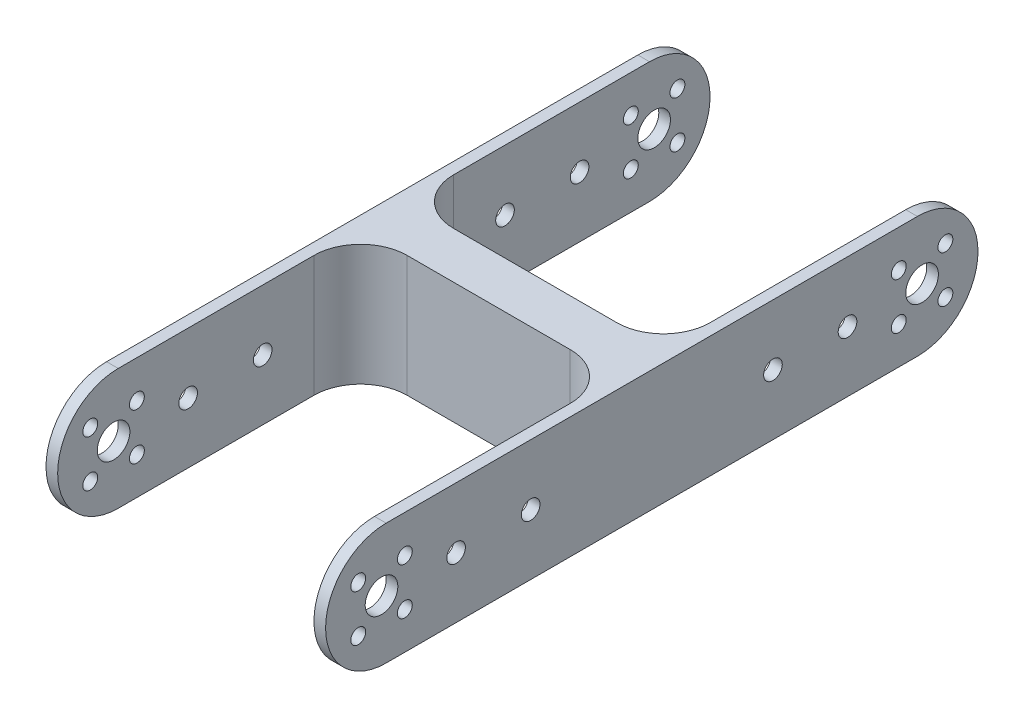
from build123d import *

# Parameters (mm, degrees)
EXTRUDE_1_DEPTH      = 26
SKETCH_2_R           = 2
SKETCH_2_R_2         = 3.5
SKETCH_2_R_3         = 1.6
CUT_EXTRUDE_2_DEPTH  = 155.518607294
CUT_EXTRUDE_5_DEPTH  = 155.518607294
SKETCH_5_R           = 10.5
CUT_EXTRUDE_6_DEPTH  = 1.6
CUT_EXTRUDE_START    = -1.6
SKETCH_6_R           = 10.5
CUT_EXTRUDE_7_DEPTH  = 1.6
SKETCH_7_R           = 10.5
CUT_EXTRUDE_8_DEPTH  = 1.6
SKETCH_8_R           = 10.5
CUT_EXTRUDE_9_DEPTH  = 1.6
SKETCH_9_W           = 55
SKETCH_9_H           = 54.794138709
CUT_EXTRUDE_11_DEPTH = 155.518607294
SKETCH_11_W          = 55
SKETCH_11_H          = 30.411722582
CUT_EXTRUDE_12_DEPTH = 155.518607294
EXTRUDE_2_DEPTH      = 26


with BuildPart() as part:
    # 草图1 → 凸台-拉伸1 (new body)
    with BuildSketch(Plane(origin=(0, 0, 0), x_dir=(1, 0, 0), z_dir=(0, 1, 0))):
        with BuildLine():
            Line((0, 0), (0, 140))
            Line((0, 140), (5, 140))
            Line((5, 140), (5, 85))
            ThreePointArc((5, 85), (7.928932188, 77.928932188), (15, 75))
            Line((15, 75), (45, 75))
            ThreePointArc((45, 75), (52.071067812, 77.928932188), (55, 85))
            Line((55, 85), (55, 140))
            Line((55, 140), (60, 140))
            Line((60, 140), (60, 0))
            Line((60, 0), (55, 0))
            Line((55, 0), (55, 55))
            ThreePointArc((55, 55), (52.071067812, 62.071067812), (45, 65))
            Line((45, 65), (15, 65))
            ThreePointArc((15, 65), (7.928932188, 62.071067812), (5, 55))
            Line((5, 55), (5, 0))
            Line((5, 0), (0, 0))
        make_face()
    extrude(amount=EXTRUDE_1_DEPTH)

    # 草图2 → 切除-拉伸2 (cut, through all)
    with BuildSketch(Plane(origin=(60, 0, 0), x_dir=(0, 0, -1), z_dir=(1, 0, 0))):
        with Locations((44, 13)):
            Circle(SKETCH_2_R)
        with Locations((28, 13)):
            Circle(SKETCH_2_R)
        with Locations((12, 13)):
            Circle(SKETCH_2_R_2)
        with Locations((7, 8)):
            Circle(SKETCH_2_R_3)
        with Locations((7, 18)):
            Circle(SKETCH_2_R_3)
        with Locations((17, 8)):
            Circle(SKETCH_2_R_3)
        with Locations((17, 18)):
            Circle(SKETCH_2_R_3)
        with Locations((96, 13)):
            Circle(SKETCH_2_R)
        with Locations((112, 13)):
            Circle(SKETCH_2_R)
        with Locations((123, 18)):
            Circle(SKETCH_2_R_3)
        with Locations((133, 18)):
            Circle(SKETCH_2_R_3)
        with Locations((133, 8)):
            Circle(SKETCH_2_R_3)
        with Locations((128, 13)):
            Circle(SKETCH_2_R_2)
        with Locations((123, 8)):
            Circle(SKETCH_2_R_3)
    extrude(amount=-CUT_EXTRUDE_2_DEPTH, mode=Mode.SUBTRACT)

    # 草图3 → 切除-拉伸5 (cut, through all)
    with BuildSketch(Plane.ZY):
        with BuildLine():
            Line((-127, 26), (-140, 26))
            Line((-140, 26), (-140, 13))
            ThreePointArc((-140, 13), (-136.192388155, 22.192388155), (-127, 26))
        make_face()
        with BuildLine():
            ThreePointArc((-127, 0), (-136.192388155, 3.807611845), (-140, 13))
            Line((-140, 13), (-140, 0))
            Line((-140, 0), (-127, 0))
        make_face()
        with BuildLine():
            Line((0, 26), (-13, 26))
            ThreePointArc((-13, 26), (-3.807611845, 22.192388155), (0, 13))
            Line((0, 13), (0, 26))
        make_face()
        with BuildLine():
            ThreePointArc((0, 13), (-3.807611845, 3.807611845), (-13, 0))
            Line((-13, 0), (0, 0))
            Line((0, 0), (0, 13))
        make_face()
    extrude(amount=-CUT_EXTRUDE_5_DEPTH, mode=Mode.SUBTRACT)

    # 草图5 → 切除-拉伸6 (cut)
    with BuildSketch(Plane.ZY.offset(-55)):
        with Locations((-128, 13)):
            Circle(SKETCH_5_R)
    extrude(amount=-CUT_EXTRUDE_6_DEPTH, mode=Mode.SUBTRACT)

    # 草图6 → 切除-拉伸7 (cut)
    with BuildSketch(Plane(origin=(5, 0, 0), x_dir=(0, 0, -1), z_dir=(1, 0, 0)).offset(CUT_EXTRUDE_START)):
        with Locations((128, 13)):
            Circle(SKETCH_6_R)
    extrude(amount=CUT_EXTRUDE_7_DEPTH, mode=Mode.SUBTRACT)

    # 草图7 → 切除-拉伸8 (cut)
    with BuildSketch(Plane.ZY.offset(-55)):
        with Locations((-12, 13)):
            Circle(SKETCH_7_R)
    extrude(amount=-CUT_EXTRUDE_8_DEPTH, mode=Mode.SUBTRACT)

    # 草图8 → 切除-拉伸9 (cut)
    with BuildSketch(Plane(origin=(5, 0, 0), x_dir=(0, 0, -1), z_dir=(1, 0, 0)).offset(CUT_EXTRUDE_START)):
        with Locations((12, 13)):
            Circle(SKETCH_8_R)
    extrude(amount=CUT_EXTRUDE_9_DEPTH, mode=Mode.SUBTRACT)

    # 草图9 → 切除-拉伸11 (cut, through all)
    with BuildSketch(Plane(origin=(0, 26, 0), x_dir=(1, 0, 0), z_dir=(0, 1, 0))):
        with Locations((30, 112.602930646)):
            Rectangle(SKETCH_9_W, SKETCH_9_H)
        with Locations((30, 27.397069355)):
            Rectangle(SKETCH_9_W, SKETCH_9_H)
    extrude(amount=-CUT_EXTRUDE_11_DEPTH, mode=Mode.SUBTRACT)

    # 草图11 → 切除-拉伸12 (cut, through all)
    with BuildSketch(Plane(origin=(0, 26, 0), x_dir=(1, 0, 0), z_dir=(0, 1, 0))):
        with Locations((30, 70)):
            Rectangle(SKETCH_11_W, SKETCH_11_H)
    extrude(amount=-CUT_EXTRUDE_12_DEPTH, mode=Mode.SUBTRACT)


with BuildPart() as cut_extrude_12_piece_1:
    # of the separate pieces the step leaves, piece 1, a body of its own (cut_extrude_12_pieces)
    add(part.part.solids().sort_by_distance((60, 0, -127))[0])



with BuildPart() as cut_extrude_12_piece_2:
    # of the separate pieces the step leaves, piece 2, a body of its own (cut_extrude_12_pieces)
    add(part.part.solids().sort_by_distance((0, 26, -127))[0])


with BuildPart() as cut_extrude_12_piece_1_1:
    add(cut_extrude_12_piece_1.part)

    add(cut_extrude_12_piece_2.part)  # 凸台-拉伸2 merges 切除-拉伸12 piece 2
    # 草图12 → 凸台-拉伸2 (add)
    with BuildSketch(Plane(origin=(0, 26, 0), x_dir=(1, 0, 0), z_dir=(0, 1, 0))):
        with BuildLine():
            ThreePointArc((2.5, 55), (5.428932188, 62.071067812), (12.5, 65))
            Line((12.5, 65), (47.5, 65))
            ThreePointArc((47.5, 65), (54.571067812, 62.071067812), (57.5, 55))
            Line((57.5, 55), (57.5, 85))
            ThreePointArc((57.5, 85), (54.571067812, 77.928932188), (47.5, 75))
            Line((47.5, 75), (12.5, 75))
            ThreePointArc((12.5, 75), (5.428932188, 77.928932188), (2.5, 85))
            Line((2.5, 85), (2.5, 55))
        make_face()
    extrude(amount=-EXTRUDE_2_DEPTH)


solid = cut_extrude_12_piece_1_1.part
